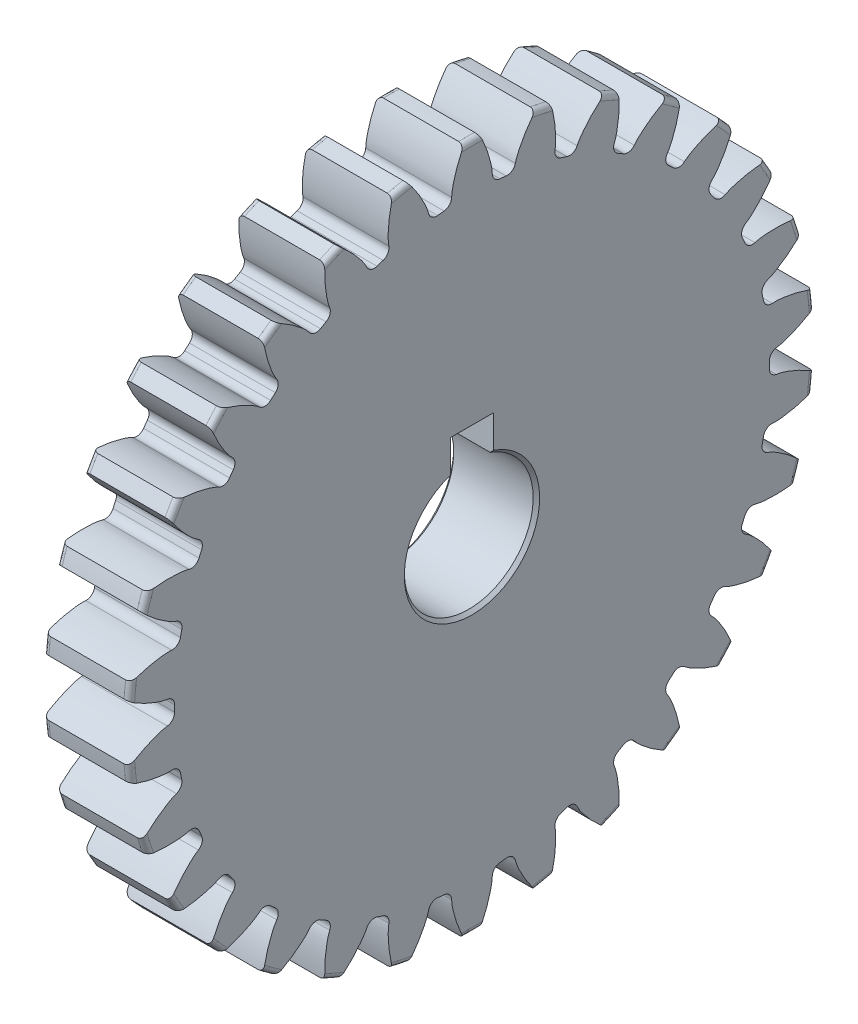
from build123d import *

# Parameters (mm, degrees)
SKETCH1_W                = 9
SKETCH1_H                = 16
CUT_EXTRUDE1_DEPTH       = 25.351591324
CUT_EXTRUDE2_DEPTH       = 25.351591492
CUT_EXTRUDE3_DEPTH       = 25.351591492
CUT_EXTRUDE4_DEPTH       = 25.351591492
CUT_EXTRUDE5_DEPTH       = 25.351591492
CUT_EXTRUDE6_DEPTH       = 25.351591492
CUT_EXTRUDE7_DEPTH       = 25.351591492
CUT_EXTRUDE8_DEPTH       = 25.351591492
CUT_EXTRUDE9_DEPTH       = 25.351591492
CUT_EXTRUDE10_DEPTH      = 25.351591492
CUT_EXTRUDE11_DEPTH      = 25.351591492
CUT_EXTRUDE12_DEPTH      = 25.351591492
CUT_EXTRUDE13_DEPTH      = 25.351591492
CUT_EXTRUDE14_DEPTH      = 25.351591492
CUT_EXTRUDE15_DEPTH      = 25.351591492
CUT_EXTRUDE16_DEPTH      = 25.351591492
CUT_EXTRUDE17_DEPTH      = 25.351591492
CUT_EXTRUDE18_DEPTH      = 25.351591492
CUT_EXTRUDE19_DEPTH      = 25.351591492
CUT_EXTRUDE20_DEPTH      = 25.351591492
CUT_EXTRUDE21_DEPTH      = 25.351591492
CUT_EXTRUDE22_DEPTH      = 25.351591492
CUT_EXTRUDE23_DEPTH      = 25.351591492
CUT_EXTRUDE24_DEPTH      = 25.316579405
CUT_EXTRUDE25_DEPTH      = 25.316579405
CUT_EXTRUDE26_DEPTH      = 25.316579405
CUT_EXTRUDE27_DEPTH      = 25.316579405
CUT_EXTRUDE28_DEPTH      = 25.316579405
CUT_EXTRUDE29_DEPTH      = 25.316579405
CUT_EXTRUDE30_DEPTH      = 25.316579405
FILLET2_R                = 0.39
SKETCH40_W               = 5.946393302
SKETCH40_H               = 34.763530071
SKETCH40_W_2             = 6.26658371
CUT_EXTRUDE31_DEPTH      = 20
F_4_0_4_DIAMETER_HOLE1_D = 6
CUT_EXTRUDE32_DEPTH      = 24.136465443
SKETCH44_W               = 2.236431062
SKETCH44_H               = 33.546465929
SKETCH44_W_2             = 4.204490396
CUT_EXTRUDE33_DEPTH      = 50
CHAMFER1_SIZE            = 0.15
FILLET3_R                = 0.25


with BuildPart() as part:
    # Sketch1 → Revolve1 (revolve)
    with BuildSketch(Plane.XY):
        with Locations((0, 8)):
            Rectangle(SKETCH1_W, SKETCH1_H)
    revolve(axis=Axis((-4.5, 0, 0), (1, 0, 0)))

    # Sketch2 → Cut-Extrude1 (cut, through all)
    with BuildSketch(Plane.ZY.offset(4.5)):
        with BuildLine():
            ThreePointArc((0.954056391, 13.810084192), (1.446987187, 13.767166632), (1.938069328, 13.706660289))
            add(Edge.make_bspline(
                [(1.938069328, 13.706660289), (1.965001199, 13.819362607), (1.991206245, 13.932241789), (2.018962603, 14.04474389), (2.05920042, 14.20783585), (2.123494581, 14.364974044), (2.195334167, 14.516819832), (2.266765719, 14.667803166), (2.344804973, 14.81587551), (2.429738644, 14.959697293), (2.54009773, 15.146573006), (2.662330321, 15.326687166), (2.792289678, 15.50050381), (2.848499158, 15.575682261), (2.906178722, 15.649778454), (2.965092777, 15.722856764)],
                knots=[-0.000345313, -0.000345313, -0.000345313, -0.000345313, 0, 0, 0, 0.000503947, 0.000503947, 0.000503947, 0.001003754, 0.001003754, 0.001003754, 0.001653534, 0.001653534, 0.001653534, 0.001934332, 0.001934332, 0.001934332, 0.001934332], degree=3))
            ThreePointArc((2.965092777, 15.722856764), (1.672455412, 15.912350326), (0.368667349, 15.995752073))
            add(Edge.make_bspline(
                [(0.368667349, 15.995752073), (0.411100156, 15.912021779), (0.452113817, 15.82755251), (0.491464506, 15.74233028), (0.561466025, 15.590727204), (0.626352147, 15.436564899), (0.683841754, 15.279789103), (0.741350469, 15.122961194), (0.791812877, 14.963342867), (0.834422005, 14.801829067), (0.890003895, 14.591140826), (0.938153875, 14.375380258), (0.945223023, 14.157598467), (0.948982336, 14.041783957), (0.951145416, 13.92592313), (0.954056391, 13.810084192)],
                knots=[-0.000281528, -0.000281528, -0.000281528, -0.000281528, 0, 0, 0, 0.000500952, 0.000500952, 0.000500952, 0.001002152, 0.001002152, 0.001002152, 0.00165773, 0.00165773, 0.00165773, 0.002003061, 0.002003061, 0.002003061, 0.002003061], degree=3))
        make_face()
    extrude(amount=-CUT_EXTRUDE1_DEPTH, mode=Mode.SUBTRACT)

    # Sketch3 → Cut-Extrude2 (cut, through all)
    with BuildSketch(Plane.ZY.offset(4.5)):
        with BuildLine():
            ThreePointArc((3.804485924, 13.309941242), (4.277721937, 13.165475458), (4.745492779, 13.004189605))
            add(Edge.make_bspline(
                [(4.745492779, 13.004189605), (4.795268254, 13.108829656), (4.844369558, 13.213793822), (4.894909876, 13.31806661), (4.968177125, 13.469228707), (5.063737172, 13.609565547), (5.165577405, 13.74315685), (5.266839206, 13.875989382), (5.373959086, 14.004600716), (5.486938983, 14.127620945), (5.633740104, 14.287468031), (5.79074946, 14.43823268), (5.954007405, 14.581230943), (6.024619052, 14.643079957), (6.096443643, 14.703564715), (6.16926412, 14.762797168)],
                knots=[-0.000345313, -0.000345313, -0.000345313, -0.000345313, 0, 0, 0, 0.000503947, 0.000503947, 0.000503947, 0.001003754, 0.001003754, 0.001003754, 0.001653534, 0.001653534, 0.001653534, 0.001934313, 0.001934313, 0.001934313, 0.001934313], degree=3))
            ThreePointArc((6.16926412, 14.762797168), (4.94427191, 15.216904261), (3.686314942, 15.56955626))
            add(Edge.make_bspline(
                [(3.686314942, 15.56955626), (3.710411983, 15.478833397), (3.732967249, 15.387682765), (3.753739334, 15.296141377), (3.790691099, 15.133297058), (3.822107159, 14.969012985), (3.845744958, 14.803710355), (3.869390615, 14.638352778), (3.885563781, 14.47173077), (3.89366119, 14.304887499), (3.904223934, 14.087247177), (3.906462577, 13.866190551), (3.868097867, 13.651698056), (3.847695839, 13.537632765), (3.825722831, 13.423854046), (3.804485924, 13.309941242)],
                knots=[-0.000281528, -0.000281528, -0.000281528, -0.000281528, 0, 0, 0, 0.000500952, 0.000500952, 0.000500952, 0.001002152, 0.001002152, 0.001002152, 0.00165773, 0.00165773, 0.00165773, 0.002003061, 0.002003061, 0.002003061, 0.002003061], degree=3))
        make_face()
    extrude(amount=-CUT_EXTRUDE2_DEPTH, mode=Mode.SUBTRACT)

    # Sketch4 → Cut-Extrude3 (cut, through all)
    with BuildSketch(Plane.ZY.offset(4.5)):
        with BuildLine():
            ThreePointArc((6.488641167, 12.22808999), (6.921499712, 11.988389831), (7.345515425, 11.733373434))
            add(Edge.make_bspline(
                [(7.345515425, 11.733373434), (7.415959076, 11.825377946), (7.485810676, 11.917839657), (7.556926098, 12.009325912), (7.660020649, 12.141951637), (7.78267015, 12.25935373), (7.910060123, 12.368851967), (8.036726547, 12.477728277), (8.168245401, 12.58125767), (8.30433376, 12.67809977), (8.481161002, 12.803932145), (8.666085059, 12.918758143), (8.855506437, 13.024688316), (8.937434184, 13.070504794), (9.020264724, 13.114734643), (9.103809017, 13.157532496)],
                knots=[-0.000345313, -0.000345313, -0.000345313, -0.000345313, 0, 0, 0, 0.000503947, 0.000503947, 0.000503947, 0.001003754, 0.001003754, 0.001003754, 0.001653534, 0.001653534, 0.001653534, 0.001934312, 0.001934312, 0.001934312, 0.001934312], degree=3))
            ThreePointArc((9.103809017, 13.157532496), (8, 13.856406461), (6.842852884, 14.462896128))
            add(Edge.make_bspline(
                [(6.842852884, 14.462896128), (6.847561003, 14.369145721), (6.8506721, 14.275297445), (6.85195774, 14.181437696), (6.854244783, 14.014469213), (6.850817747, 13.847243375), (6.839570654, 13.680638429), (6.828319823, 13.513978104), (6.809496904, 13.347634596), (6.782728698, 13.182753704), (6.747810654, 12.967673227), (6.70404012, 12.750981779), (6.621918273, 12.549152931), (6.578246571, 12.441822061), (6.5330978, 12.335098125), (6.488641167, 12.22808999)],
                knots=[-0.000281509, -0.000281509, -0.000281509, -0.000281509, 0, 0, 0, 0.000500952, 0.000500952, 0.000500952, 0.001002152, 0.001002152, 0.001002152, 0.00165773, 0.00165773, 0.00165773, 0.002003061, 0.002003061, 0.002003061, 0.002003061], degree=3))
        make_face()
    extrude(amount=-CUT_EXTRUDE3_DEPTH, mode=Mode.SUBTRACT)

    # Sketch5 → Cut-Extrude4 (cut, through all)
    with BuildSketch(Plane.ZY.offset(4.5)):
        with BuildLine():
            ThreePointArc((8.889211655, 10.611812529), (9.262774737, 10.287354041), (9.624503799, 9.949752541))
            add(Edge.make_bspline(
                [(9.624503799, 9.949752541), (9.7125369, 10.025100475), (9.800085946, 10.101018712), (9.888668388, 10.175720045), (10.017084514, 10.284013017), (10.161463097, 10.373349327), (10.308835257, 10.453968901), (10.455370373, 10.534130571), (10.605540196, 10.608053291), (10.758789302, 10.674484798), (10.957914467, 10.760802983), (11.162671157, 10.834671885), (11.369977345, 10.89890431), (11.459640555, 10.926685852), (11.549856952, 10.952727735), (11.640473776, 10.977220517)],
                knots=[-0.000345313, -0.000345313, -0.000345313, -0.000345313, 0, 0, 0, 0.000503947, 0.000503947, 0.000503947, 0.001003754, 0.001003754, 0.001003754, 0.001653534, 0.001653534, 0.001653534, 0.00193433, 0.00193433, 0.00193433, 0.00193433], degree=3))
            ThreePointArc((11.640473776, 10.977220517), (10.706089702, 11.890317208), (9.700325319, 12.724138034))
            add(Edge.make_bspline(
                [(9.700325319, 12.724138034), (9.685438748, 12.631457425), (9.668969707, 12.539013126), (9.650712713, 12.446937139), (9.618235079, 12.283141814), (9.580114725, 12.120282783), (9.534474293, 11.959656957), (9.488818689, 11.798977739), (9.435822336, 11.64018274), (9.375358415, 11.484470315), (9.296485668, 11.281349732), (9.20861894, 11.078493917), (9.086329076, 10.898149606), (9.021296363, 10.802244031), (8.954945046, 10.707239226), (8.889211655, 10.611812529)],
                knots=[-0.000281509, -0.000281509, -0.000281509, -0.000281509, 0, 0, 0, 0.000500952, 0.000500952, 0.000500952, 0.001002152, 0.001002152, 0.001002152, 0.00165773, 0.00165773, 0.00165773, 0.002003061, 0.002003061, 0.002003061, 0.002003061], degree=3))
        make_face()
    extrude(amount=-CUT_EXTRUDE4_DEPTH, mode=Mode.SUBTRACT)

    # Sketch6 → Cut-Extrude5 (cut, through all)
    with BuildSketch(Plane.ZY.offset(4.5)):
        with BuildLine():
            ThreePointArc((10.901280938, 8.53174794), (11.199222058, 8.136711516), (11.482855173, 7.731279718))
            add(Edge.make_bspline(
                [(11.482855173, 7.731279718), (11.584630256, 7.786678008), (11.686050435, 7.842734779), (11.788228418, 7.897386384), (11.936353719, 7.97661368), (12.096151346, 8.033979782), (12.257064823, 8.08219723), (12.417064344, 8.130140812), (12.579321993, 8.171226081), (12.743034126, 8.20434362), (12.955754487, 8.247375096), (13.171394961, 8.277058475), (13.387525684, 8.296785887), (13.481005645, 8.305318306), (13.574665008, 8.312034068), (13.668393973, 8.317151326)],
                knots=[-0.000345313, -0.000345313, -0.000345313, -0.000345313, 0, 0, 0, 0.000503947, 0.000503947, 0.000503947, 0.001003754, 0.001003754, 0.001003754, 0.001653534, 0.001653534, 0.001653534, 0.001934313, 0.001934313, 0.001934313, 0.001934313], degree=3))
            ThreePointArc((13.668393973, 8.317151326), (12.94427191, 9.404564037), (12.13384699, 10.429274051))
            add(Edge.make_bspline(
                [(12.13384699, 10.429274051), (12.100016344, 10.341713828), (12.06468694, 10.254713764), (12.027685232, 10.168445701), (11.961862349, 10.014982177), (11.89071472, 9.863607674), (11.812675653, 9.715981087), (11.734610646, 9.568305429), (11.649757054, 9.423999044), (11.558239981, 9.284260464), (11.438859649, 9.10197712), (11.310736924, 8.921822711), (11.153623696, 8.770844849), (11.070072214, 8.690556101), (10.985418223, 8.611422594), (10.901280938, 8.53174794)],
                knots=[-0.000281526, -0.000281526, -0.000281526, -0.000281526, 0, 0, 0, 0.000500952, 0.000500952, 0.000500952, 0.001002152, 0.001002152, 0.001002152, 0.00165773, 0.00165773, 0.00165773, 0.002003061, 0.002003061, 0.002003061, 0.002003061], degree=3))
        make_face()
    extrude(amount=-CUT_EXTRUDE5_DEPTH, mode=Mode.SUBTRACT)

    # Sketch7 → Cut-Extrude6 (cut, through all)
    with BuildSketch(Plane.ZY.offset(4.5)):
        with BuildLine():
            ThreePointArc((12.436911934, 6.078805025), (12.646209635, 5.630455653), (12.839350675, 5.174912872))
            add(Edge.make_bspline(
                [(12.839350675, 5.174912872), (12.950419681, 5.207940347), (13.061278443, 5.241685702), (13.1725863, 5.273899041), (13.333946989, 5.320598049), (13.502179738, 5.34348677), (13.66960184, 5.357194757), (13.836073019, 5.370824886), (14.003327057, 5.377277082), (14.17034721, 5.375633256), (14.387365869, 5.373497341), (14.604465602, 5.357697891), (14.81997491, 5.332058109), (14.913186099, 5.320968497), (15.006195066, 5.308064626), (15.098939766, 5.293582713)],
                knots=[-0.000345313, -0.000345313, -0.000345313, -0.000345313, 0, 0, 0, 0.000503947, 0.000503947, 0.000503947, 0.001003754, 0.001003754, 0.001003754, 0.001653534, 0.001653534, 0.001653534, 0.001934313, 0.001934313, 0.001934313, 0.001934313], degree=3))
            ThreePointArc((15.098939766, 5.293582713), (14.616727322, 6.507786289), (14.037061323, 7.678600747))
            add(Edge.make_bspline(
                [(14.037061323, 7.678600747), (13.985765164, 7.599987711), (13.933119462, 7.522234204), (13.87899019, 7.445544392), (13.782698835, 7.309119761), (13.681633423, 7.175845578), (13.574606404, 7.04767022), (13.467543809, 6.919452257), (13.354541487, 6.795941367), (13.235970997, 6.67828388), (13.081300573, 6.524804431), (12.91852143, 6.375225041), (12.73345144, 6.260212084), (12.635032789, 6.199049168), (12.53577591, 6.139245472), (12.436911934, 6.078805025)],
                knots=[-0.000281509, -0.000281509, -0.000281509, -0.000281509, 0, 0, 0, 0.000500952, 0.000500952, 0.000500952, 0.001002152, 0.001002152, 0.001002152, 0.00165773, 0.00165773, 0.00165773, 0.002003061, 0.002003061, 0.002003061, 0.002003061], degree=3))
        make_face()
    extrude(amount=-CUT_EXTRUDE6_DEPTH, mode=Mode.SUBTRACT)

    # Sketch8 → Cut-Extrude7 (cut, through all)
    with BuildSketch(Plane.ZY.offset(4.5)):
        with BuildLine():
            ThreePointArc((13.4289902, 3.360189162), (13.540497168, 2.878121861), (13.634704943, 2.392377502))
            add(Edge.make_bspline(
                [(13.634704943, 2.392377502), (13.750213623, 2.401590702), (13.865665909, 2.411549808), (13.981238951, 2.419917004), (14.148782792, 2.432046753), (14.318098084, 2.419457744), (14.484711663, 2.398057167), (14.65037891, 2.376778141), (14.815319533, 2.34831527), (14.978348125, 2.311981924), (15.190180323, 2.264771967), (15.399251016, 2.204180201), (15.604720118, 2.134293805), (15.693588759, 2.104066831), (15.781882391, 2.07210729), (15.869589438, 2.038659134)],
                knots=[-0.000345313, -0.000345313, -0.000345313, -0.000345313, 0, 0, 0, 0.000503947, 0.000503947, 0.000503947, 0.001003754, 0.001003754, 0.001003754, 0.001653534, 0.001653534, 0.001653534, 0.001934332, 0.001934332, 0.001934332, 0.001934332], degree=3))
            ThreePointArc((15.869589438, 2.038659134), (15.650361612, 3.326587053), (15.326788718, 4.592335744))
            add(Edge.make_bspline(
                [(15.326788718, 4.592335744), (15.260268935, 4.526105663), (15.192607804, 4.460996913), (15.123716679, 4.397237066), (15.001165245, 4.283813739), (14.874599094, 4.174464597), (14.743261717, 4.071342347), (14.611880683, 3.968185819), (14.475668374, 3.870868442), (14.335226567, 3.780434245), (14.152025892, 3.662466479), (13.961704559, 3.549999444), (13.756766255, 3.475978011), (13.647781801, 3.43661404), (13.538260036, 3.398753864), (13.4289902, 3.360189162)],
                knots=[-0.000281509, -0.000281509, -0.000281509, -0.000281509, 0, 0, 0, 0.000500952, 0.000500952, 0.000500952, 0.001002152, 0.001002152, 0.001002152, 0.00165773, 0.00165773, 0.00165773, 0.002003061, 0.002003061, 0.002003061, 0.002003061], degree=3))
        make_face()
    extrude(amount=-CUT_EXTRUDE7_DEPTH, mode=Mode.SUBTRACT)

    # Sketch9 → Cut-Extrude8 (cut, through all)
    with BuildSketch(Plane.ZY.offset(4.5)):
        with BuildLine():
            ThreePointArc((13.834157155, 0.494716908), (13.843, 3.32e-07), (13.834157178, -0.494716245))
            add(Edge.make_bspline(
                [(13.834157178, -0.494716245), (13.949057248, -0.50971998), (14.064057239, -0.523982384), (14.178844371, -0.539827019), (14.345248894, -0.562796657), (14.508246839, -0.610313194), (14.666770081, -0.665887029), (14.824392943, -0.721145215), (14.979811454, -0.783279187), (15.131723352, -0.852714113), (15.329111007, -0.942934809), (15.521015267, -1.045670741), (15.707464177, -1.15674938), (15.788106284, -1.204792651), (15.867825726, -1.254411078), (15.946661901, -1.305363632)],
                knots=[-0.000345313, -0.000345313, -0.000345313, -0.000345313, 0, 0, 0, 0.000503947, 0.000503947, 0.000503947, 0.001003754, 0.001003754, 0.001003754, 0.001653534, 0.001653534, 0.001653534, 0.001934332, 0.001934332, 0.001934332, 0.001934332], degree=3))
            ThreePointArc((15.946661901, -1.305363632), (16, 0), (15.946661901, 1.305363632))
            add(Edge.make_bspline(
                [(15.946661901, 1.305363632), (15.867825726, 1.254411078), (15.788106284, 1.204792651), (15.707464177, 1.15674938), (15.56400875, 1.071284501), (15.417473409, 0.990639482), (15.267565747, 0.917077277), (15.117608256, 0.84349062), (14.964139092, 0.776619992), (14.807963949, 0.717361492), (14.60423977, 0.640061168), (14.394694204, 0.569621837), (14.178844371, 0.539827019), (14.06405726, 0.523982387), (13.949057235, 0.509720402), (13.834157155, 0.494716908)],
                knots=[-0.000281528, -0.000281528, -0.000281528, -0.000281528, 0, 0, 0, 0.000500952, 0.000500952, 0.000500952, 0.001002152, 0.001002152, 0.001002152, 0.00165773, 0.00165773, 0.00165773, 0.002003061, 0.002003061, 0.002003061, 0.002003061], degree=3))
        make_face()
    extrude(amount=-CUT_EXTRUDE8_DEPTH, mode=Mode.SUBTRACT)

    # Sketch10 → Cut-Extrude9 (cut, through all)
    with BuildSketch(Plane.ZY.offset(4.5)):
        with BuildLine():
            ThreePointArc((13.634705058, -2.392376848), (13.540497306, -2.878121211), (13.428990361, -3.360188518))
            add(Edge.make_bspline(
                [(13.428990361, -3.360188518), (13.538260137, -3.398753453), (13.647781782, -3.436614033), (13.756766255, -3.475978011), (13.914758783, -3.533043153), (14.064315588, -3.613410518), (14.207820267, -3.700728766), (14.350509868, -3.787551064), (14.489613733, -3.880640585), (14.623769659, -3.980142451), (14.798085982, -4.109430809), (14.964436673, -4.249820854), (15.123716679, -4.397237066), (15.192607804, -4.460996913), (15.260268935, -4.526105663), (15.326788718, -4.592335744)],
                knots=[-0.000345313, -0.000345313, -0.000345313, -0.000345313, 0, 0, 0, 0.000503947, 0.000503947, 0.000503947, 0.001003754, 0.001003754, 0.001003754, 0.001653534, 0.001653534, 0.001653534, 0.001934332, 0.001934332, 0.001934332, 0.001934332], degree=3))
            ThreePointArc((15.326788718, -4.592335744), (15.650361612, -3.326587053), (15.869589438, -2.038659134))
            add(Edge.make_bspline(
                [(15.869589438, -2.038659134), (15.781882391, -2.07210729), (15.693588759, -2.104066831), (15.604720118, -2.134293805), (15.446630389, -2.188065011), (15.286530154, -2.236481332), (15.124603892, -2.277268471), (14.962623805, -2.318069168), (14.798605126, -2.351570478), (14.633522249, -2.3770634), (14.418178291, -2.410317888), (14.198566638, -2.435650977), (13.981238951, -2.419917003), (13.86566593, -2.41154981), (13.750213698, -2.401590286), (13.634705058, -2.392376848)],
                knots=[-0.000281528, -0.000281528, -0.000281528, -0.000281528, 0, 0, 0, 0.000500952, 0.000500952, 0.000500952, 0.001002152, 0.001002152, 0.001002152, 0.00165773, 0.00165773, 0.00165773, 0.002003061, 0.002003061, 0.002003061, 0.002003061], degree=3))
        make_face()
    extrude(amount=-CUT_EXTRUDE9_DEPTH, mode=Mode.SUBTRACT)

    # Sketch11 → Cut-Extrude10 (cut, through all)
    with BuildSketch(Plane.ZY.offset(4.5)):
        with BuildLine():
            ThreePointArc((12.839350924, -5.174912256), (12.646209905, -5.630455047), (12.436912226, -6.078804429))
            add(Edge.make_bspline(
                [(12.436912226, -6.078804429), (12.535776094, -6.139245092), (12.635032771, -6.199049157), (12.73345144, -6.260212084), (12.876126942, -6.348878709), (13.005706258, -6.458584462), (13.127920531, -6.573830898), (13.249440651, -6.688422756), (13.366150363, -6.808399368), (13.476687059, -6.933619465), (13.620313591, -7.096324964), (13.753840388, -7.268233402), (13.87899019, -7.445544392), (13.933119462, -7.522234204), (13.985765164, -7.599987711), (14.037061323, -7.678600747)],
                knots=[-0.000345313, -0.000345313, -0.000345313, -0.000345313, 0, 0, 0, 0.000503947, 0.000503947, 0.000503947, 0.001003754, 0.001003754, 0.001003754, 0.001653534, 0.001653534, 0.001653534, 0.001934313, 0.001934313, 0.001934313, 0.001934313], degree=3))
            ThreePointArc((14.037061323, -7.678600747), (14.616727322, -6.507786289), (15.098939766, -5.293582713))
            add(Edge.make_bspline(
                [(15.098939766, -5.293582713), (15.006195066, -5.308064626), (14.913186099, -5.320968497), (14.81997491, -5.332058109), (14.654160158, -5.351785582), (14.487492178, -5.36585718), (14.32062427, -5.372086659), (14.153700895, -5.378318209), (13.986301104, -5.376986035), (13.819525407, -5.367599214), (13.601973235, -5.355354486), (13.381893578, -5.334474156), (13.1725863, -5.273899041), (13.061278463, -5.241685708), (12.950419841, -5.207939956), (12.839350924, -5.174912256)],
                knots=[-0.000281528, -0.000281528, -0.000281528, -0.000281528, 0, 0, 0, 0.000500952, 0.000500952, 0.000500952, 0.001002152, 0.001002152, 0.001002152, 0.00165773, 0.00165773, 0.00165773, 0.002003061, 0.002003061, 0.002003061, 0.002003061], degree=3))
        make_face()
    extrude(amount=-CUT_EXTRUDE10_DEPTH, mode=Mode.SUBTRACT)

    # Sketch12 → Cut-Extrude11 (cut, through all)
    with BuildSketch(Plane.ZY.offset(4.5)):
        with BuildLine():
            ThreePointArc((11.482855544, -7.731279167), (11.199222448, -8.136710979), (10.901281347, -8.531747417))
            add(Edge.make_bspline(
                [(10.901281347, -8.531747417), (10.985418482, -8.61142226), (11.070072199, -8.690556086), (11.153623696, -8.770844848), (11.274746568, -8.8872378), (11.378685156, -9.021487274), (11.474267673, -9.159625075), (11.5693073, -9.29697828), (11.658522084, -9.438598428), (11.740608566, -9.584064037), (11.847268139, -9.773075665), (11.942135281, -9.968989274), (12.027685232, -10.168445701), (12.06468694, -10.254713764), (12.100016344, -10.341713828), (12.13384699, -10.429274051)],
                knots=[-0.000345313, -0.000345313, -0.000345313, -0.000345313, 0, 0, 0, 0.000503947, 0.000503947, 0.000503947, 0.001003754, 0.001003754, 0.001003754, 0.001653534, 0.001653534, 0.001653534, 0.00193433, 0.00193433, 0.00193433, 0.00193433], degree=3))
            ThreePointArc((12.13384699, -10.429274051), (12.94427191, -9.404564037), (13.668393973, -8.317151326))
            add(Edge.make_bspline(
                [(13.668393973, -8.317151326), (13.574665008, -8.312034068), (13.481005645, -8.305318306), (13.387525684, -8.296785887), (13.22123281, -8.281607443), (13.055281276, -8.260719321), (12.890764651, -8.232118882), (12.72619334, -8.203508937), (12.56272861, -8.1674015), (12.401548992, -8.123545187), (12.191296678, -8.066336395), (11.980367555, -8.000155217), (11.788228418, -7.897386383), (11.686050453, -7.842734789), (11.584630494, -7.786677658), (11.482855544, -7.731279167)],
                knots=[-0.000281509, -0.000281509, -0.000281509, -0.000281509, 0, 0, 0, 0.000500952, 0.000500952, 0.000500952, 0.001002152, 0.001002152, 0.001002152, 0.00165773, 0.00165773, 0.00165773, 0.002003061, 0.002003061, 0.002003061, 0.002003061], degree=3))
        make_face()
    extrude(amount=-CUT_EXTRUDE11_DEPTH, mode=Mode.SUBTRACT)

    # Sketch13 → Cut-Extrude12 (cut, through all)
    with BuildSketch(Plane.ZY.offset(4.5)):
        with BuildLine():
            ThreePointArc((9.624504276, -9.949752079), (9.262775231, -10.287353597), (8.889212164, -10.611812103))
            add(Edge.make_bspline(
                [(8.889212164, -10.611812103), (8.954945369, -10.707238954), (9.021296351, -10.802244013), (9.086329076, -10.898149606), (9.180605667, -11.037181954), (9.254360912, -11.190107803), (9.319134258, -11.345099683), (9.383539704, -11.499211241), (9.441360447, -11.656285446), (9.491409141, -11.815639021), (9.556440219, -12.022696064), (9.608501557, -12.234052479), (9.650712713, -12.446937139), (9.668969707, -12.539013126), (9.685438748, -12.631457425), (9.700325319, -12.724138034)],
                knots=[-0.000345313, -0.000345313, -0.000345313, -0.000345313, 0, 0, 0, 0.000503947, 0.000503947, 0.000503947, 0.001003754, 0.001003754, 0.001003754, 0.001653534, 0.001653534, 0.001653534, 0.001934313, 0.001934313, 0.001934313, 0.001934313], degree=3))
            ThreePointArc((9.700325319, -12.724138034), (10.706089702, -11.890317208), (11.640473776, -10.977220517))
            add(Edge.make_bspline(
                [(11.640473776, -10.977220517), (11.549856952, -10.952727735), (11.459640555, -10.926685852), (11.369977345, -10.89890431), (11.210474146, -10.849483319), (11.052491936, -10.794548388), (10.897516759, -10.732368008), (10.742490068, -10.670166959), (10.590104593, -10.600862328), (10.441565377, -10.524453254), (10.247801957, -10.424780698), (10.055241982, -10.316191106), (9.888668388, -10.175720045), (9.800085962, -10.101018725), (9.712537205, -10.025100183), (9.624504276, -9.949752079)],
                knots=[-0.000281526, -0.000281526, -0.000281526, -0.000281526, 0, 0, 0, 0.000500952, 0.000500952, 0.000500952, 0.001002152, 0.001002152, 0.001002152, 0.00165773, 0.00165773, 0.00165773, 0.002003061, 0.002003061, 0.002003061, 0.002003061], degree=3))
        make_face()
    extrude(amount=-CUT_EXTRUDE12_DEPTH, mode=Mode.SUBTRACT)

    # Sketch14 → Cut-Extrude13 (cut, through all)
    with BuildSketch(Plane.ZY.offset(4.5)):
        with BuildLine():
            ThreePointArc((7.345515988, -11.733373082), (6.921500288, -11.988389499), (6.488641754, -12.228089679))
            add(Edge.make_bspline(
                [(6.488641754, -12.228089679), (6.533098173, -12.335097926), (6.578246564, -12.441822042), (6.621918273, -12.549152931), (6.685228245, -12.704748294), (6.725576689, -12.869666924), (6.756709958, -13.034738996), (6.787666396, -13.198873491), (6.811566053, -13.364536856), (6.827389592, -13.530813882), (6.847950005, -13.746866954), (6.854930208, -13.964428884), (6.85195774, -14.181437696), (6.8506721, -14.275297445), (6.847561003, -14.369145721), (6.842852884, -14.462896128)],
                knots=[-0.000345313, -0.000345313, -0.000345313, -0.000345313, 0, 0, 0, 0.000503947, 0.000503947, 0.000503947, 0.001003754, 0.001003754, 0.001003754, 0.001653534, 0.001653534, 0.001653534, 0.001934313, 0.001934313, 0.001934313, 0.001934313], degree=3))
            ThreePointArc((6.842852884, -14.462896128), (8, -13.856406461), (9.103809017, -13.157532496))
            add(Edge.make_bspline(
                [(9.103809017, -13.157532496), (9.020264724, -13.114734643), (8.937434184, -13.070504794), (8.855506437, -13.024688316), (8.709763967, -12.943184712), (8.566655662, -12.856603893), (8.427995092, -12.763561152), (8.289288432, -12.670487484), (8.154642189, -12.571014603), (8.02523525, -12.465392212), (7.856429116, -12.32761206), (7.690654084, -12.181359941), (7.556926098, -12.009325912), (7.485810689, -11.917839674), (7.415959435, -11.825377723), (7.345515988, -11.733373082)],
                knots=[-0.000281507, -0.000281507, -0.000281507, -0.000281507, 0, 0, 0, 0.000500952, 0.000500952, 0.000500952, 0.001002152, 0.001002152, 0.001002152, 0.00165773, 0.00165773, 0.00165773, 0.002003061, 0.002003061, 0.002003061, 0.002003061], degree=3))
        make_face()
    extrude(amount=-CUT_EXTRUDE13_DEPTH, mode=Mode.SUBTRACT)

    # Sketch15 → Cut-Extrude14 (cut, through all)
    with BuildSketch(Plane.ZY.offset(4.5)):
        with BuildLine():
            ThreePointArc((4.745493403, -13.004189377), (4.277722569, -13.165475252), (3.804486563, -13.309941059))
            add(Edge.make_bspline(
                [(3.804486563, -13.309941059), (3.825723237, -13.423853928), (3.847695836, -13.537632745), (3.868097867, -13.651698056), (3.897674269, -13.81705617), (3.902852491, -13.986759845), (3.89898501, -14.154697666), (3.895139495, -14.321681635), (3.884073537, -14.488693876), (3.864980356, -14.654627249), (3.840171515, -14.870233792), (3.801765515, -15.084492739), (3.753739334, -15.296141377), (3.732967249, -15.387682765), (3.710411983, -15.478833397), (3.686314942, -15.56955626)],
                knots=[-0.000345313, -0.000345313, -0.000345313, -0.000345313, 0, 0, 0, 0.000503947, 0.000503947, 0.000503947, 0.001003754, 0.001003754, 0.001003754, 0.001653534, 0.001653534, 0.001653534, 0.001934332, 0.001934332, 0.001934332, 0.001934332], degree=3))
            ThreePointArc((3.686314942, -15.56955626), (4.94427191, -15.216904261), (6.16926412, -14.762797168))
            add(Edge.make_bspline(
                [(6.16926412, -14.762797168), (6.096443643, -14.703564715), (6.024619052, -14.643079957), (5.954007405, -14.581230943), (5.82839531, -14.471206825), (5.706415428, -14.356764115), (5.590129599, -14.236925428), (5.473805116, -14.117046906), (5.36278279, -13.991753219), (5.258163834, -13.861533714), (5.121692623, -13.69166762), (4.989947698, -13.514144894), (4.894909876, -13.31806661), (4.844369567, -13.21379384), (4.795268651, -13.108829513), (4.745493403, -13.004189377)],
                knots=[-0.000281509, -0.000281509, -0.000281509, -0.000281509, 0, 0, 0, 0.000500952, 0.000500952, 0.000500952, 0.001002152, 0.001002152, 0.001002152, 0.00165773, 0.00165773, 0.00165773, 0.002003061, 0.002003061, 0.002003061, 0.002003061], degree=3))
        make_face()
    extrude(amount=-CUT_EXTRUDE14_DEPTH, mode=Mode.SUBTRACT)

    # Sketch16 → Cut-Extrude15 (cut, through all)
    with BuildSketch(Plane.ZY.offset(4.5)):
        with BuildLine():
            ThreePointArc((1.938069985, -13.706660196), (1.446987847, -13.767166563), (0.954057053, -13.810084147))
            add(Edge.make_bspline(
                [(0.954057053, -13.810084147), (0.951145838, -13.925923099), (0.948982336, -14.041783936), (0.945223023, -14.157598467), (0.939773224, -14.325492389), (0.909554912, -14.492564245), (0.870855708, -14.656028127), (0.832376307, -14.818563568), (0.78682837, -14.979625449), (0.733652933, -15.137963084), (0.664559104, -15.343700059), (0.582445427, -15.545291877), (0.491464506, -15.74233028), (0.452113817, -15.82755251), (0.411100156, -15.912021779), (0.368667349, -15.995752073)],
                knots=[-0.000345313, -0.000345313, -0.000345313, -0.000345313, 0, 0, 0, 0.000503947, 0.000503947, 0.000503947, 0.001003754, 0.001003754, 0.001003754, 0.001653534, 0.001653534, 0.001653534, 0.001934332, 0.001934332, 0.001934332, 0.001934332], degree=3))
            ThreePointArc((0.368667349, -15.995752073), (1.672455412, -15.912350326), (2.965092777, -15.722856764))
            add(Edge.make_bspline(
                [(2.965092777, -15.722856764), (2.906178722, -15.649778454), (2.848499158, -15.575682261), (2.792289678, -15.50050381), (2.692297809, -15.366767759), (2.596777458, -15.229464853), (2.507948617, -15.088067746), (2.419090249, -14.946623638), (2.33654405, -14.800985078), (2.261285427, -14.651859678), (2.163113586, -14.457331606), (2.071156654, -14.256296867), (2.018962603, -14.04474389), (1.99120625, -13.932241809), (1.965001617, -13.81936255), (1.938069985, -13.706660196)],
                knots=[-0.000281528, -0.000281528, -0.000281528, -0.000281528, 0, 0, 0, 0.000500952, 0.000500952, 0.000500952, 0.001002152, 0.001002152, 0.001002152, 0.00165773, 0.00165773, 0.00165773, 0.002003061, 0.002003061, 0.002003061, 0.002003061], degree=3))
        make_face()
    extrude(amount=-CUT_EXTRUDE15_DEPTH, mode=Mode.SUBTRACT)

    # Sketch17 → Cut-Extrude16 (cut, through all)
    with BuildSketch(Plane.ZY.offset(4.5)):
        with BuildLine():
            ThreePointArc((-0.954056391, -13.810084192), (-1.446987187, -13.767166632), (-1.938069328, -13.706660289))
            add(Edge.make_bspline(
                [(-1.938069328, -13.706660289), (-1.965001199, -13.819362607), (-1.991206245, -13.932241789), (-2.018962603, -14.04474389), (-2.05920042, -14.20783585), (-2.123494581, -14.364974044), (-2.195334167, -14.516819832), (-2.266765719, -14.667803166), (-2.344804973, -14.81587551), (-2.429738644, -14.959697293), (-2.54009773, -15.146573006), (-2.662330321, -15.326687166), (-2.792289678, -15.50050381), (-2.848499158, -15.575682261), (-2.906178722, -15.649778454), (-2.965092777, -15.722856764)],
                knots=[-0.000345313, -0.000345313, -0.000345313, -0.000345313, 0, 0, 0, 0.000503947, 0.000503947, 0.000503947, 0.001003754, 0.001003754, 0.001003754, 0.001653534, 0.001653534, 0.001653534, 0.001934332, 0.001934332, 0.001934332, 0.001934332], degree=3))
            ThreePointArc((-2.965092777, -15.722856764), (-1.672455412, -15.912350326), (-0.368667349, -15.995752073))
            add(Edge.make_bspline(
                [(-0.368667349, -15.995752073), (-0.411100156, -15.912021779), (-0.452113817, -15.82755251), (-0.491464506, -15.74233028), (-0.561466025, -15.590727204), (-0.626352147, -15.436564899), (-0.683841754, -15.279789103), (-0.741350469, -15.122961194), (-0.791812877, -14.963342867), (-0.834422005, -14.801829067), (-0.890003895, -14.591140826), (-0.938153875, -14.375380258), (-0.945223023, -14.157598467), (-0.948982336, -14.041783957), (-0.951145416, -13.92592313), (-0.954056391, -13.810084192)],
                knots=[-0.000281528, -0.000281528, -0.000281528, -0.000281528, 0, 0, 0, 0.000500952, 0.000500952, 0.000500952, 0.001002152, 0.001002152, 0.001002152, 0.00165773, 0.00165773, 0.00165773, 0.002003061, 0.002003061, 0.002003061, 0.002003061], degree=3))
        make_face()
    extrude(amount=-CUT_EXTRUDE16_DEPTH, mode=Mode.SUBTRACT)

    # Sketch18 → Cut-Extrude17 (cut, through all)
    with BuildSketch(Plane.ZY.offset(4.5)):
        with BuildLine():
            ThreePointArc((-3.804485924, -13.309941242), (-4.277721937, -13.165475458), (-4.745492779, -13.004189605))
            add(Edge.make_bspline(
                [(-4.745492779, -13.004189605), (-4.795268254, -13.108829656), (-4.844369558, -13.213793822), (-4.894909876, -13.31806661), (-4.968177125, -13.469228707), (-5.063737172, -13.609565547), (-5.165577405, -13.74315685), (-5.266839206, -13.875989382), (-5.373959086, -14.004600716), (-5.486938983, -14.127620945), (-5.633740104, -14.287468031), (-5.79074946, -14.43823268), (-5.954007405, -14.581230943), (-6.024619052, -14.643079957), (-6.096443643, -14.703564715), (-6.16926412, -14.762797168)],
                knots=[-0.000345313, -0.000345313, -0.000345313, -0.000345313, 0, 0, 0, 0.000503947, 0.000503947, 0.000503947, 0.001003754, 0.001003754, 0.001003754, 0.001653534, 0.001653534, 0.001653534, 0.001934313, 0.001934313, 0.001934313, 0.001934313], degree=3))
            ThreePointArc((-6.16926412, -14.762797168), (-4.94427191, -15.216904261), (-3.686314942, -15.56955626))
            add(Edge.make_bspline(
                [(-3.686314942, -15.56955626), (-3.710411983, -15.478833397), (-3.732967249, -15.387682765), (-3.753739334, -15.296141377), (-3.790691099, -15.133297058), (-3.822107159, -14.969012985), (-3.845744958, -14.803710355), (-3.869390615, -14.638352778), (-3.885563781, -14.47173077), (-3.89366119, -14.304887499), (-3.904223934, -14.087247177), (-3.906462577, -13.866190551), (-3.868097867, -13.651698056), (-3.847695839, -13.537632765), (-3.825722831, -13.423854046), (-3.804485924, -13.309941242)],
                knots=[-0.000281528, -0.000281528, -0.000281528, -0.000281528, 0, 0, 0, 0.000500952, 0.000500952, 0.000500952, 0.001002152, 0.001002152, 0.001002152, 0.00165773, 0.00165773, 0.00165773, 0.002003061, 0.002003061, 0.002003061, 0.002003061], degree=3))
        make_face()
    extrude(amount=-CUT_EXTRUDE17_DEPTH, mode=Mode.SUBTRACT)

    # Sketch19 → Cut-Extrude18 (cut, through all)
    with BuildSketch(Plane.ZY.offset(4.5)):
        with BuildLine():
            ThreePointArc((-6.488641167, -12.22808999), (-6.921499713, -11.988389831), (-7.345515425, -11.733373434))
            add(Edge.make_bspline(
                [(-7.345515425, -11.733373434), (-7.415959076, -11.825377946), (-7.485810676, -11.917839657), (-7.556926098, -12.009325912), (-7.660020649, -12.141951637), (-7.78267015, -12.25935373), (-7.910060123, -12.368851967), (-8.036726547, -12.477728277), (-8.168245401, -12.58125767), (-8.30433376, -12.67809977), (-8.481161002, -12.803932145), (-8.666085059, -12.918758143), (-8.855506437, -13.024688316), (-8.937434184, -13.070504794), (-9.020264724, -13.114734643), (-9.103809017, -13.157532496)],
                knots=[-0.000345313, -0.000345313, -0.000345313, -0.000345313, 0, 0, 0, 0.000503947, 0.000503947, 0.000503947, 0.001003754, 0.001003754, 0.001003754, 0.001653534, 0.001653534, 0.001653534, 0.001934312, 0.001934312, 0.001934312, 0.001934312], degree=3))
            ThreePointArc((-9.103809017, -13.157532496), (-8, -13.856406461), (-6.842852884, -14.462896128))
            add(Edge.make_bspline(
                [(-6.842852884, -14.462896128), (-6.847561003, -14.369145721), (-6.8506721, -14.275297445), (-6.85195774, -14.181437696), (-6.854244783, -14.014469213), (-6.850817747, -13.847243375), (-6.839570654, -13.680638429), (-6.828319823, -13.513978104), (-6.809496904, -13.347634596), (-6.782728698, -13.182753704), (-6.747810654, -12.967673227), (-6.70404012, -12.750981779), (-6.621918273, -12.549152931), (-6.578246571, -12.441822061), (-6.5330978, -12.335098125), (-6.488641167, -12.22808999)],
                knots=[-0.000281509, -0.000281509, -0.000281509, -0.000281509, 0, 0, 0, 0.000500952, 0.000500952, 0.000500952, 0.001002152, 0.001002152, 0.001002152, 0.00165773, 0.00165773, 0.00165773, 0.002003061, 0.002003061, 0.002003061, 0.002003061], degree=3))
        make_face()
    extrude(amount=-CUT_EXTRUDE18_DEPTH, mode=Mode.SUBTRACT)

    # Sketch20 → Cut-Extrude19 (cut, through all)
    with BuildSketch(Plane.ZY.offset(4.5)):
        with BuildLine():
            ThreePointArc((-8.889211655, -10.611812529), (-9.262774737, -10.287354041), (-9.624503799, -9.949752541))
            add(Edge.make_bspline(
                [(-9.624503799, -9.949752541), (-9.7125369, -10.025100475), (-9.800085946, -10.101018712), (-9.888668388, -10.175720045), (-10.017084514, -10.284013017), (-10.161463097, -10.373349327), (-10.308835257, -10.453968901), (-10.455370373, -10.534130571), (-10.605540196, -10.608053291), (-10.758789302, -10.674484798), (-10.957914467, -10.760802983), (-11.162671157, -10.834671885), (-11.369977345, -10.89890431), (-11.459640555, -10.926685852), (-11.549856952, -10.952727735), (-11.640473776, -10.977220517)],
                knots=[-0.000345313, -0.000345313, -0.000345313, -0.000345313, 0, 0, 0, 0.000503947, 0.000503947, 0.000503947, 0.001003754, 0.001003754, 0.001003754, 0.001653534, 0.001653534, 0.001653534, 0.00193433, 0.00193433, 0.00193433, 0.00193433], degree=3))
            ThreePointArc((-11.640473776, -10.977220517), (-10.706089702, -11.890317208), (-9.700325319, -12.724138034))
            add(Edge.make_bspline(
                [(-9.700325319, -12.724138034), (-9.685438748, -12.631457425), (-9.668969707, -12.539013126), (-9.650712713, -12.446937139), (-9.618235079, -12.283141814), (-9.580114725, -12.120282783), (-9.534474293, -11.959656957), (-9.488818689, -11.798977739), (-9.435822336, -11.64018274), (-9.375358415, -11.484470315), (-9.296485668, -11.281349732), (-9.20861894, -11.078493917), (-9.086329076, -10.898149606), (-9.021296363, -10.802244031), (-8.954945046, -10.707239226), (-8.889211655, -10.611812529)],
                knots=[-0.000281509, -0.000281509, -0.000281509, -0.000281509, 0, 0, 0, 0.000500952, 0.000500952, 0.000500952, 0.001002152, 0.001002152, 0.001002152, 0.00165773, 0.00165773, 0.00165773, 0.002003061, 0.002003061, 0.002003061, 0.002003061], degree=3))
        make_face()
    extrude(amount=-CUT_EXTRUDE19_DEPTH, mode=Mode.SUBTRACT)

    # Sketch21 → Cut-Extrude20 (cut, through all)
    with BuildSketch(Plane.ZY.offset(4.5)):
        with BuildLine():
            ThreePointArc((-10.901280938, -8.53174794), (-11.199222058, -8.136711516), (-11.482855173, -7.731279718))
            add(Edge.make_bspline(
                [(-11.482855173, -7.731279718), (-11.584630256, -7.786678008), (-11.686050435, -7.842734779), (-11.788228418, -7.897386384), (-11.936353719, -7.97661368), (-12.096151346, -8.033979782), (-12.257064823, -8.08219723), (-12.417064344, -8.130140812), (-12.579321993, -8.171226081), (-12.743034126, -8.20434362), (-12.955754487, -8.247375096), (-13.171394961, -8.277058475), (-13.387525684, -8.296785887), (-13.481005645, -8.305318306), (-13.574665008, -8.312034068), (-13.668393973, -8.317151326)],
                knots=[-0.000345313, -0.000345313, -0.000345313, -0.000345313, 0, 0, 0, 0.000503947, 0.000503947, 0.000503947, 0.001003754, 0.001003754, 0.001003754, 0.001653534, 0.001653534, 0.001653534, 0.001934313, 0.001934313, 0.001934313, 0.001934313], degree=3))
            ThreePointArc((-13.668393973, -8.317151326), (-12.94427191, -9.404564037), (-12.13384699, -10.429274051))
            add(Edge.make_bspline(
                [(-12.13384699, -10.429274051), (-12.100016344, -10.341713828), (-12.06468694, -10.254713764), (-12.027685232, -10.168445701), (-11.961862349, -10.014982177), (-11.89071472, -9.863607674), (-11.812675653, -9.715981087), (-11.734610646, -9.568305429), (-11.649757054, -9.423999044), (-11.558239981, -9.284260464), (-11.438859649, -9.10197712), (-11.310736924, -8.921822711), (-11.153623696, -8.770844849), (-11.070072214, -8.690556101), (-10.985418223, -8.611422594), (-10.901280938, -8.53174794)],
                knots=[-0.000281526, -0.000281526, -0.000281526, -0.000281526, 0, 0, 0, 0.000500952, 0.000500952, 0.000500952, 0.001002152, 0.001002152, 0.001002152, 0.00165773, 0.00165773, 0.00165773, 0.002003061, 0.002003061, 0.002003061, 0.002003061], degree=3))
        make_face()
    extrude(amount=-CUT_EXTRUDE20_DEPTH, mode=Mode.SUBTRACT)

    # Sketch22 → Cut-Extrude21 (cut, through all)
    with BuildSketch(Plane.ZY.offset(4.5)):
        with BuildLine():
            ThreePointArc((-12.436911934, -6.078805025), (-12.646209635, -5.630455653), (-12.839350675, -5.174912872))
            add(Edge.make_bspline(
                [(-12.839350675, -5.174912872), (-12.950419681, -5.207940347), (-13.061278443, -5.241685702), (-13.1725863, -5.273899041), (-13.333946989, -5.320598049), (-13.502179738, -5.34348677), (-13.66960184, -5.357194757), (-13.836073019, -5.370824886), (-14.003327057, -5.377277081), (-14.17034721, -5.375633256), (-14.387365869, -5.373497341), (-14.604465602, -5.357697891), (-14.81997491, -5.332058109), (-14.913186099, -5.320968497), (-15.006195066, -5.308064626), (-15.098939766, -5.293582713)],
                knots=[-0.000345313, -0.000345313, -0.000345313, -0.000345313, 0, 0, 0, 0.000503947, 0.000503947, 0.000503947, 0.001003754, 0.001003754, 0.001003754, 0.001653534, 0.001653534, 0.001653534, 0.001934332, 0.001934332, 0.001934332, 0.001934332], degree=3))
            ThreePointArc((-15.098939766, -5.293582713), (-14.616727322, -6.507786289), (-14.037061323, -7.678600747))
            add(Edge.make_bspline(
                [(-14.037061323, -7.678600747), (-13.985765164, -7.599987711), (-13.933119462, -7.522234204), (-13.87899019, -7.445544392), (-13.782698835, -7.309119761), (-13.681633423, -7.175845578), (-13.574606404, -7.04767022), (-13.467543809, -6.919452257), (-13.354541487, -6.795941367), (-13.235970997, -6.67828388), (-13.081300573, -6.524804431), (-12.91852143, -6.375225041), (-12.73345144, -6.260212084), (-12.635032789, -6.199049168), (-12.53577591, -6.139245472), (-12.436911934, -6.078805025)],
                knots=[-0.000281509, -0.000281509, -0.000281509, -0.000281509, 0, 0, 0, 0.000500952, 0.000500952, 0.000500952, 0.001002152, 0.001002152, 0.001002152, 0.00165773, 0.00165773, 0.00165773, 0.002003061, 0.002003061, 0.002003061, 0.002003061], degree=3))
        make_face()
    extrude(amount=-CUT_EXTRUDE21_DEPTH, mode=Mode.SUBTRACT)

    # Sketch23 → Cut-Extrude22 (cut, through all)
    with BuildSketch(Plane.ZY.offset(4.5)):
        with BuildLine():
            ThreePointArc((-13.4289902, -3.360189162), (-13.540497168, -2.878121861), (-13.634704943, -2.392377502))
            add(Edge.make_bspline(
                [(-13.634704943, -2.392377502), (-13.750213623, -2.401590702), (-13.865665909, -2.411549808), (-13.981238951, -2.419917003), (-14.148782792, -2.432046753), (-14.318098084, -2.419457744), (-14.484711663, -2.398057167), (-14.65037891, -2.376778141), (-14.815319533, -2.34831527), (-14.978348125, -2.311981924), (-15.190180323, -2.264771967), (-15.399251016, -2.204180201), (-15.604720118, -2.134293805), (-15.693588759, -2.104066831), (-15.781882391, -2.07210729), (-15.869589438, -2.038659134)],
                knots=[-0.000345313, -0.000345313, -0.000345313, -0.000345313, 0, 0, 0, 0.000503947, 0.000503947, 0.000503947, 0.001003754, 0.001003754, 0.001003754, 0.001653534, 0.001653534, 0.001653534, 0.001934332, 0.001934332, 0.001934332, 0.001934332], degree=3))
            ThreePointArc((-15.869589438, -2.038659134), (-15.650361612, -3.326587053), (-15.326788718, -4.592335744))
            add(Edge.make_bspline(
                [(-15.326788718, -4.592335744), (-15.260268935, -4.526105663), (-15.192607804, -4.460996913), (-15.123716679, -4.397237066), (-15.001165245, -4.283813739), (-14.874599094, -4.174464597), (-14.743261717, -4.071342347), (-14.611880683, -3.968185819), (-14.475668374, -3.870868442), (-14.335226567, -3.780434245), (-14.152025892, -3.662466479), (-13.961704559, -3.549999444), (-13.756766255, -3.475978011), (-13.647781801, -3.43661404), (-13.538260036, -3.398753864), (-13.4289902, -3.360189162)],
                knots=[-0.000281528, -0.000281528, -0.000281528, -0.000281528, 0, 0, 0, 0.000500952, 0.000500952, 0.000500952, 0.001002152, 0.001002152, 0.001002152, 0.00165773, 0.00165773, 0.00165773, 0.002003061, 0.002003061, 0.002003061, 0.002003061], degree=3))
        make_face()
    extrude(amount=-CUT_EXTRUDE22_DEPTH, mode=Mode.SUBTRACT)

    # Sketch24 → Cut-Extrude23 (cut, through all)
    with BuildSketch(Plane.ZY.offset(4.5)):
        with BuildLine():
            ThreePointArc((-15.946661901, 1.305363632), (-16, 0), (-15.946661901, -1.305363632))
            add(Edge.make_bspline(
                [(-15.946661901, -1.305363632), (-15.867825726, -1.254411078), (-15.788106284, -1.204792651), (-15.707464177, -1.15674938), (-15.56400875, -1.071284501), (-15.417473409, -0.990639482), (-15.267565747, -0.917077277), (-15.117608256, -0.84349062), (-14.964139092, -0.776619992), (-14.807963949, -0.717361492), (-14.60423977, -0.640061168), (-14.394694204, -0.569621837), (-14.178844371, -0.539827019), (-14.06405726, -0.523982387), (-13.949057235, -0.509720402), (-13.834157155, -0.494716908)],
                knots=[-0.000281528, -0.000281528, -0.000281528, -0.000281528, 0, 0, 0, 0.000500952, 0.000500952, 0.000500952, 0.001002152, 0.001002152, 0.001002152, 0.00165773, 0.00165773, 0.00165773, 0.002003061, 0.002003061, 0.002003061, 0.002003061], degree=3))
            ThreePointArc((-13.834157155, -0.494716908), (-13.843, -3.32e-07), (-13.834157178, 0.494716245))
            add(Edge.make_bspline(
                [(-13.834157178, 0.494716245), (-13.949057248, 0.50971998), (-14.064057239, 0.523982384), (-14.178844371, 0.539827019), (-14.345248894, 0.562796657), (-14.508246839, 0.610313194), (-14.666770081, 0.665887029), (-14.824392943, 0.721145215), (-14.979811454, 0.783279187), (-15.131723352, 0.852714113), (-15.329111007, 0.942934809), (-15.521015267, 1.045670741), (-15.707464177, 1.15674938), (-15.788106284, 1.204792651), (-15.867825726, 1.254411078), (-15.946661901, 1.305363632)],
                knots=[-0.000345313, -0.000345313, -0.000345313, -0.000345313, 0, 0, 0, 0.000503947, 0.000503947, 0.000503947, 0.001003754, 0.001003754, 0.001003754, 0.001653534, 0.001653534, 0.001653534, 0.001934332, 0.001934332, 0.001934332, 0.001934332], degree=3))
        make_face()
    extrude(amount=-CUT_EXTRUDE23_DEPTH, mode=Mode.SUBTRACT)

    # Sketch25 → Cut-Extrude24 (cut, through all)
    with BuildSketch(Plane.ZY.offset(4.5)):
        with BuildLine():
            ThreePointArc((-15.326788718, 4.592335744), (-15.650361612, 3.326587053), (-15.869589438, 2.038659134))
            add(Edge.make_bspline(
                [(-15.869589438, 2.038659134), (-15.781882391, 2.07210729), (-15.693588759, 2.104066831), (-15.604720118, 2.134293805), (-15.446630389, 2.188065011), (-15.286530154, 2.236481332), (-15.124603892, 2.277268471), (-14.962623805, 2.318069168), (-14.798605126, 2.351570478), (-14.633522249, 2.3770634), (-14.418178291, 2.410317888), (-14.198566638, 2.435650977), (-13.981238951, 2.419917003), (-13.86566593, 2.41154981), (-13.750213698, 2.401590286), (-13.634705058, 2.392376848)],
                knots=[-0.000281528, -0.000281528, -0.000281528, -0.000281528, 0, 0, 0, 0.000500952, 0.000500952, 0.000500952, 0.001002152, 0.001002152, 0.001002152, 0.00165773, 0.00165773, 0.00165773, 0.002003061, 0.002003061, 0.002003061, 0.002003061], degree=3))
            ThreePointArc((-13.634705058, 2.392376848), (-13.540497306, 2.878121211), (-13.428990361, 3.360188518))
            add(Edge.make_bspline(
                [(-13.428990361, 3.360188518), (-13.538260137, 3.398753453), (-13.647781782, 3.436614033), (-13.756766255, 3.475978011), (-13.914758783, 3.533043153), (-14.064315588, 3.613410518), (-14.207820267, 3.700728766), (-14.350509868, 3.787551064), (-14.489613733, 3.880640585), (-14.623769659, 3.980142451), (-14.798085982, 4.109430809), (-14.964436673, 4.249820854), (-15.123716679, 4.397237066), (-15.192607804, 4.460996913), (-15.260268935, 4.526105663), (-15.326788718, 4.592335744)],
                knots=[-0.000345313, -0.000345313, -0.000345313, -0.000345313, 0, 0, 0, 0.000503947, 0.000503947, 0.000503947, 0.001003754, 0.001003754, 0.001003754, 0.001653534, 0.001653534, 0.001653534, 0.001934313, 0.001934313, 0.001934313, 0.001934313], degree=3))
        make_face()
    extrude(amount=-CUT_EXTRUDE24_DEPTH, mode=Mode.SUBTRACT)

    # Sketch26 → Cut-Extrude25 (cut, through all)
    with BuildSketch(Plane.ZY.offset(4.5)):
        with BuildLine():
            ThreePointArc((-14.037061323, 7.678600747), (-14.616727322, 6.507786289), (-15.098939766, 5.293582713))
            add(Edge.make_bspline(
                [(-15.098939766, 5.293582713), (-15.006195066, 5.308064626), (-14.913186099, 5.320968497), (-14.81997491, 5.332058109), (-14.654160158, 5.351785582), (-14.487492178, 5.36585718), (-14.32062427, 5.372086659), (-14.153700895, 5.378318209), (-13.986301104, 5.376986035), (-13.819525407, 5.367599214), (-13.601973235, 5.355354486), (-13.381893578, 5.334474156), (-13.1725863, 5.273899041), (-13.061278463, 5.241685708), (-12.950419841, 5.207939956), (-12.839350924, 5.174912256)],
                knots=[-0.000281509, -0.000281509, -0.000281509, -0.000281509, 0, 0, 0, 0.000500952, 0.000500952, 0.000500952, 0.001002152, 0.001002152, 0.001002152, 0.00165773, 0.00165773, 0.00165773, 0.002003061, 0.002003061, 0.002003061, 0.002003061], degree=3))
            ThreePointArc((-12.839350924, 5.174912256), (-12.646209905, 5.630455047), (-12.436912226, 6.078804429))
            add(Edge.make_bspline(
                [(-12.436912226, 6.078804429), (-12.535776094, 6.139245092), (-12.635032771, 6.199049157), (-12.73345144, 6.260212083), (-12.876126942, 6.348878709), (-13.005706258, 6.458584462), (-13.127920531, 6.573830898), (-13.249440651, 6.688422756), (-13.366150363, 6.808399368), (-13.476687059, 6.933619465), (-13.620313591, 7.096324964), (-13.753840388, 7.268233402), (-13.87899019, 7.445544392), (-13.933119462, 7.522234204), (-13.985765164, 7.599987711), (-14.037061323, 7.678600747)],
                knots=[-0.000345313, -0.000345313, -0.000345313, -0.000345313, 0, 0, 0, 0.000503947, 0.000503947, 0.000503947, 0.001003754, 0.001003754, 0.001003754, 0.001653534, 0.001653534, 0.001653534, 0.001934313, 0.001934313, 0.001934313, 0.001934313], degree=3))
        make_face()
    extrude(amount=-CUT_EXTRUDE25_DEPTH, mode=Mode.SUBTRACT)

    # Sketch27 → Cut-Extrude26 (cut, through all)
    with BuildSketch(Plane.ZY.offset(4.5)):
        with BuildLine():
            ThreePointArc((-12.13384699, 10.429274051), (-12.94427191, 9.404564037), (-13.668393973, 8.317151326))
            add(Edge.make_bspline(
                [(-13.668393973, 8.317151326), (-13.574665008, 8.312034068), (-13.481005645, 8.305318306), (-13.387525684, 8.296785887), (-13.22123281, 8.281607443), (-13.055281276, 8.260719321), (-12.890764651, 8.232118882), (-12.72619334, 8.203508937), (-12.56272861, 8.1674015), (-12.401548992, 8.123545187), (-12.191296678, 8.066336395), (-11.980367555, 8.000155217), (-11.788228418, 7.897386383), (-11.686050453, 7.842734789), (-11.584630494, 7.786677658), (-11.482855544, 7.731279167)],
                knots=[-0.000281509, -0.000281509, -0.000281509, -0.000281509, 0, 0, 0, 0.000500952, 0.000500952, 0.000500952, 0.001002152, 0.001002152, 0.001002152, 0.00165773, 0.00165773, 0.00165773, 0.002003061, 0.002003061, 0.002003061, 0.002003061], degree=3))
            ThreePointArc((-11.482855544, 7.731279167), (-11.199222448, 8.136710979), (-10.901281347, 8.531747417))
            add(Edge.make_bspline(
                [(-10.901281347, 8.531747417), (-10.985418482, 8.61142226), (-11.070072199, 8.690556086), (-11.153623696, 8.770844848), (-11.274746568, 8.8872378), (-11.378685156, 9.021487274), (-11.474267673, 9.159625075), (-11.5693073, 9.29697828), (-11.658522084, 9.438598428), (-11.740608566, 9.584064037), (-11.847268139, 9.773075665), (-11.942135281, 9.968989274), (-12.027685232, 10.168445701), (-12.06468694, 10.254713764), (-12.100016344, 10.341713828), (-12.13384699, 10.429274051)],
                knots=[-0.000345313, -0.000345313, -0.000345313, -0.000345313, 0, 0, 0, 0.000503947, 0.000503947, 0.000503947, 0.001003754, 0.001003754, 0.001003754, 0.001653534, 0.001653534, 0.001653534, 0.00193433, 0.00193433, 0.00193433, 0.00193433], degree=3))
        make_face()
    extrude(amount=-CUT_EXTRUDE26_DEPTH, mode=Mode.SUBTRACT)

    # Sketch28 → Cut-Extrude27 (cut, through all)
    with BuildSketch(Plane.ZY.offset(4.5)):
        with BuildLine():
            ThreePointArc((-9.700325319, 12.724138034), (-10.706089702, 11.890317208), (-11.640473776, 10.977220517))
            add(Edge.make_bspline(
                [(-11.640473776, 10.977220517), (-11.549856952, 10.952727735), (-11.459640555, 10.926685852), (-11.369977345, 10.89890431), (-11.210474146, 10.849483319), (-11.052491936, 10.794548388), (-10.897516759, 10.732368008), (-10.742490068, 10.670166959), (-10.590104593, 10.600862328), (-10.441565377, 10.524453254), (-10.247801957, 10.424780698), (-10.055241982, 10.316191106), (-9.888668388, 10.175720045), (-9.800085962, 10.101018725), (-9.712537205, 10.025100183), (-9.624504276, 9.949752079)],
                knots=[-0.000281526, -0.000281526, -0.000281526, -0.000281526, 0, 0, 0, 0.000500952, 0.000500952, 0.000500952, 0.001002152, 0.001002152, 0.001002152, 0.00165773, 0.00165773, 0.00165773, 0.002003061, 0.002003061, 0.002003061, 0.002003061], degree=3))
            ThreePointArc((-9.624504276, 9.949752079), (-9.262775231, 10.287353597), (-8.889212164, 10.611812103))
            add(Edge.make_bspline(
                [(-8.889212164, 10.611812103), (-8.954945369, 10.707238954), (-9.021296351, 10.802244013), (-9.086329076, 10.898149606), (-9.180605667, 11.037181954), (-9.254360912, 11.190107803), (-9.319134258, 11.345099683), (-9.383539704, 11.499211241), (-9.441360447, 11.656285446), (-9.491409141, 11.815639021), (-9.556440219, 12.022696064), (-9.608501557, 12.234052479), (-9.650712713, 12.446937139), (-9.668969707, 12.539013126), (-9.685438748, 12.631457425), (-9.700325319, 12.724138034)],
                knots=[-0.000345313, -0.000345313, -0.000345313, -0.000345313, 0, 0, 0, 0.000503947, 0.000503947, 0.000503947, 0.001003754, 0.001003754, 0.001003754, 0.001653534, 0.001653534, 0.001653534, 0.001934313, 0.001934313, 0.001934313, 0.001934313], degree=3))
        make_face()
    extrude(amount=-CUT_EXTRUDE27_DEPTH, mode=Mode.SUBTRACT)

    # Sketch29 → Cut-Extrude28 (cut, through all)
    with BuildSketch(Plane.ZY.offset(4.5)):
        with BuildLine():
            ThreePointArc((-6.842852884, 14.462896128), (-8, 13.856406461), (-9.103809017, 13.157532496))
            add(Edge.make_bspline(
                [(-9.103809017, 13.157532496), (-9.020264724, 13.114734643), (-8.937434184, 13.070504794), (-8.855506437, 13.024688316), (-8.709763967, 12.943184712), (-8.566655662, 12.856603893), (-8.427995092, 12.763561152), (-8.289288432, 12.670487484), (-8.154642189, 12.571014603), (-8.02523525, 12.465392212), (-7.856429116, 12.32761206), (-7.690654084, 12.181359941), (-7.556926098, 12.009325912), (-7.485810689, 11.917839674), (-7.415959435, 11.825377723), (-7.345515988, 11.733373082)],
                knots=[-0.000281507, -0.000281507, -0.000281507, -0.000281507, 0, 0, 0, 0.000500952, 0.000500952, 0.000500952, 0.001002152, 0.001002152, 0.001002152, 0.00165773, 0.00165773, 0.00165773, 0.002003061, 0.002003061, 0.002003061, 0.002003061], degree=3))
            ThreePointArc((-7.345515988, 11.733373082), (-6.921500288, 11.988389499), (-6.488641754, 12.228089679))
            add(Edge.make_bspline(
                [(-6.488641754, 12.228089679), (-6.533098173, 12.335097926), (-6.578246564, 12.441822042), (-6.621918273, 12.549152931), (-6.685228245, 12.704748294), (-6.725576689, 12.869666924), (-6.756709958, 13.034738996), (-6.787666396, 13.198873491), (-6.811566053, 13.364536856), (-6.827389592, 13.530813882), (-6.847950005, 13.746866954), (-6.854930208, 13.964428884), (-6.85195774, 14.181437696), (-6.8506721, 14.275297445), (-6.847561003, 14.369145721), (-6.842852884, 14.462896128)],
                knots=[-0.000345313, -0.000345313, -0.000345313, -0.000345313, 0, 0, 0, 0.000503947, 0.000503947, 0.000503947, 0.001003754, 0.001003754, 0.001003754, 0.001653534, 0.001653534, 0.001653534, 0.001934313, 0.001934313, 0.001934313, 0.001934313], degree=3))
        make_face()
    extrude(amount=-CUT_EXTRUDE28_DEPTH, mode=Mode.SUBTRACT)

    # Sketch30 → Cut-Extrude29 (cut, through all)
    with BuildSketch(Plane.ZY.offset(4.5)):
        with BuildLine():
            ThreePointArc((-3.686314942, 15.56955626), (-4.94427191, 15.216904261), (-6.16926412, 14.762797168))
            add(Edge.make_bspline(
                [(-6.16926412, 14.762797168), (-6.096443643, 14.703564715), (-6.024619052, 14.643079957), (-5.954007405, 14.581230943), (-5.82839531, 14.471206825), (-5.706415428, 14.356764115), (-5.590129599, 14.236925428), (-5.473805116, 14.117046906), (-5.36278279, 13.991753219), (-5.258163834, 13.861533714), (-5.121692623, 13.69166762), (-4.989947698, 13.514144894), (-4.894909876, 13.31806661), (-4.844369567, 13.21379384), (-4.795268651, 13.108829513), (-4.745493403, 13.004189377)],
                knots=[-0.000281509, -0.000281509, -0.000281509, -0.000281509, 0, 0, 0, 0.000500952, 0.000500952, 0.000500952, 0.001002152, 0.001002152, 0.001002152, 0.00165773, 0.00165773, 0.00165773, 0.002003061, 0.002003061, 0.002003061, 0.002003061], degree=3))
            ThreePointArc((-4.745493403, 13.004189377), (-4.277722569, 13.165475252), (-3.804486563, 13.309941059))
            add(Edge.make_bspline(
                [(-3.804486563, 13.309941059), (-3.825723237, 13.423853928), (-3.847695836, 13.537632745), (-3.868097867, 13.651698056), (-3.897674269, 13.81705617), (-3.902852491, 13.986759845), (-3.89898501, 14.154697666), (-3.895139495, 14.321681635), (-3.884073537, 14.488693876), (-3.864980356, 14.654627249), (-3.840171515, 14.870233792), (-3.801765515, 15.084492739), (-3.753739334, 15.296141377), (-3.732967249, 15.387682765), (-3.710411983, 15.478833397), (-3.686314942, 15.56955626)],
                knots=[-0.000345313, -0.000345313, -0.000345313, -0.000345313, 0, 0, 0, 0.000503947, 0.000503947, 0.000503947, 0.001003754, 0.001003754, 0.001003754, 0.001653534, 0.001653534, 0.001653534, 0.001934332, 0.001934332, 0.001934332, 0.001934332], degree=3))
        make_face()
    extrude(amount=-CUT_EXTRUDE29_DEPTH, mode=Mode.SUBTRACT)

    # Sketch31 → Cut-Extrude30 (cut, through all)
    with BuildSketch(Plane.ZY.offset(4.5)):
        with BuildLine():
            ThreePointArc((-0.368667349, 15.995752073), (-1.672455412, 15.912350326), (-2.965092777, 15.722856764))
            add(Edge.make_bspline(
                [(-2.965092777, 15.722856764), (-2.906178722, 15.649778454), (-2.848499158, 15.575682261), (-2.792289678, 15.50050381), (-2.692297809, 15.366767759), (-2.596777458, 15.229464853), (-2.507948617, 15.088067746), (-2.419090249, 14.946623638), (-2.33654405, 14.800985078), (-2.261285427, 14.651859678), (-2.163113586, 14.457331606), (-2.071156654, 14.256296867), (-2.018962603, 14.04474389), (-1.99120625, 13.932241809), (-1.965001617, 13.81936255), (-1.938069985, 13.706660196)],
                knots=[-0.000281528, -0.000281528, -0.000281528, -0.000281528, 0, 0, 0, 0.000500952, 0.000500952, 0.000500952, 0.001002152, 0.001002152, 0.001002152, 0.00165773, 0.00165773, 0.00165773, 0.002003061, 0.002003061, 0.002003061, 0.002003061], degree=3))
            ThreePointArc((-1.938069985, 13.706660196), (-1.446987847, 13.767166563), (-0.954057053, 13.810084147))
            add(Edge.make_bspline(
                [(-0.954057053, 13.810084147), (-0.951145838, 13.925923099), (-0.948982336, 14.041783936), (-0.945223023, 14.157598467), (-0.939773224, 14.325492389), (-0.909554912, 14.492564245), (-0.870855708, 14.656028127), (-0.832376307, 14.818563568), (-0.78682837, 14.979625449), (-0.733652933, 15.137963084), (-0.664559104, 15.343700059), (-0.582445427, 15.545291877), (-0.491464506, 15.74233028), (-0.452113817, 15.82755251), (-0.411100156, 15.912021779), (-0.368667349, 15.995752073)],
                knots=[-0.000345313, -0.000345313, -0.000345313, -0.000345313, 0, 0, 0, 0.000503947, 0.000503947, 0.000503947, 0.001003754, 0.001003754, 0.001003754, 0.001653534, 0.001653534, 0.001653534, 0.001934332, 0.001934332, 0.001934332, 0.001934332], degree=3))
        make_face()
    extrude(amount=-CUT_EXTRUDE30_DEPTH, mode=Mode.SUBTRACT)

    # Fillet2
    fillet2_edges = [part.edges().sort_by_distance(p)[0] for p in [
        (0, -0.494716908, -13.834157155),
        (0, 9.949752079, -9.624504276),
        (0, 5.174912256, -12.839350924),
        (0, -13.810084147, 0.954057053),
        (0, 13.004189377, -4.745493403),
        (0, -13.706660196, 1.938069985),
        (0, 2.392376848, -13.634705058),
        (0, -13.810084192, -0.954056391),
        (0, 7.731279167, -11.482855544),
        (0, -13.706660289, -1.938069328),
        (0, 11.733373082, -7.345515988),
        (0, -13.309941059, 3.804486563),
        (0, 13.810084147, -0.954057053),
        (0, -13.004189377, 4.745493403),
        (0, 2.392377502, 13.634704943),
        (0, -13.309941242, -3.804485924),
        (0, 5.174912872, 12.839350675),
        (0, -13.004189605, -4.745492779),
        (0, 7.731279718, 11.482855173),
        (0, -12.228089679, 6.488641754),
        (0, 9.949752541, 9.624503799),
        (0, -11.733373082, 7.345515988),
        (0, 11.733373434, 7.345515425),
        (0, -12.22808999, -6.488641167),
        (0, 13.004189605, 4.745492779),
        (0, -11.733373434, -7.345515425),
        (0, 13.706660289, 1.938069328),
        (0, -10.611812103, 8.889212164),
        (0, 0.494716908, 13.834157155),
        (0, -9.949752079, 9.624504276),
        (0, 0.494716245, -13.834157178),
        (0, -10.611812529, -8.889211655),
        (0, 3.360189162, 13.4289902),
        (0, -9.949752541, -9.624503799),
        (0, 3.360188518, -13.428990361),
        (0, -8.531747417, 10.901281347),
        (0, 6.078805025, 12.436911934),
        (0, -7.731279167, 11.482855544),
        (0, 6.078804429, -12.436912226),
        (0, -8.53174794, -10.901280938),
        (0, 8.53174794, 10.901280938),
        (0, -7.731279718, -11.482855173),
        (0, 8.531747417, -10.901281347),
        (0, -6.078804429, 12.436912226),
        (0, 10.611812529, 8.889211655),
        (0, -5.174912256, 12.839350924),
        (0, 10.611812103, -8.889212164),
        (0, -6.078805025, -12.436911934),
        (0, 12.22808999, 6.488641167),
        (0, -5.174912872, -12.839350675),
        (0, 12.228089679, -6.488641754),
        (0, -3.360188518, 13.428990361),
        (0, 13.309941242, 3.804485924),
        (0, -2.392376848, 13.634705058),
        (0, 13.309941059, -3.804486563),
        (0, -3.360189162, -13.4289902),
        (0, 13.810084192, 0.954056391),
        (0, -2.392377502, -13.634704943),
        (0, -0.494716245, 13.834157178),
        (0, 13.706660196, -1.938069985),
    ]]
    fillet(fillet2_edges, radius=FILLET2_R)

    # Sketch40 → Cut-Extrude31 (cut, symmetric)
    with BuildSketch(Plane(origin=(0, 0, 0), x_dir=(1, 0, 0), z_dir=(0, 1, 0))):
        with Locations((-5.473196651, -0.160095205)):
            Rectangle(SKETCH40_W, SKETCH40_H)
        with Locations((5.633291855, -0.160095205)):
            Rectangle(SKETCH40_W_2, SKETCH40_H)
    extrude(amount=CUT_EXTRUDE31_DEPTH, both=True, mode=Mode.SUBTRACT)

    # Ø4.0 (4) Diameter Hole1 (through all)
    with Locations(Plane.ZY.offset(2.5)):
        with Locations((0, 0)):
            Hole(F_4_0_4_DIAMETER_HOLE1_D / 2)

    # Sketch43 → Cut-Extrude32 (cut, through all)
    with BuildSketch(Plane(origin=(2.5, 0, 0), x_dir=(0, 0, -1), z_dir=(1, 0, 0))):
        with BuildLine():
            Line((-1, 2.828427125), (-1, 4.5))
            Line((-1, 4.5), (1, 4.5))
            Line((1, 4.5), (1, 2.828427125))
            ThreePointArc((1, 2.828427125), (0, 3), (-1, 2.828427125))
        make_face()
    extrude(amount=-CUT_EXTRUDE32_DEPTH, mode=Mode.SUBTRACT)

    # Sketch44 → Cut-Extrude33 (cut, symmetric)
    with BuildSketch(Plane(origin=(0, 0, 0), x_dir=(1, 0, 0), z_dir=(0, 1, 0))):
        with Locations((-3.118215531, 0.022364311)):
            Rectangle(SKETCH44_W, SKETCH44_H)
        with Locations((4.102245198, 0.022364311)):
            Rectangle(SKETCH44_W_2, SKETCH44_H)
    extrude(amount=CUT_EXTRUDE33_DEPTH, both=True, mode=Mode.SUBTRACT)

    # Chamfer1
    chamfer1_edges = [part.edges().sort_by_distance(p)[0] for p in [
        (2, -3, 0),
        (-2, -3, 0),
    ]]
    chamfer(chamfer1_edges, length=CHAMFER1_SIZE)

    # Fillet3
    fillet3_edges = [part.edges().sort_by_distance(p)[0] for p in [
        (-2, 15.650361612, -3.326587053),
        (-2, 16, 0),
        (-2, 15.650361612, 3.326587053),
        (-2, 14.616727322, 6.507786289),
        (-2, 12.94427191, 9.404564037),
        (-2, 10.706089702, 11.890317208),
        (-2, 8, 13.856406461),
        (-2, 4.94427191, 15.216904261),
        (-2, 1.672455412, 15.912350326),
        (-2, -1.672455412, 15.912350326),
        (-2, -4.94427191, 15.216904261),
        (-2, -8, 13.856406461),
        (-2, -10.706089702, 11.890317208),
        (-2, -12.94427191, 9.404564037),
        (-2, -14.616727322, 6.507786289),
        (-2, -15.650361612, 3.326587053),
        (-2, -16, 0),
        (-2, -15.650361612, -3.326587053),
        (-2, -14.616727322, -6.507786289),
        (-2, -12.94427191, -9.404564037),
        (-2, -10.706089702, -11.890317208),
        (-2, -8, -13.856406461),
        (-2, -4.94427191, -15.216904261),
        (-2, -1.672455412, -15.912350326),
        (-2, 1.672455412, -15.912350326),
        (-2, 4.94427191, -15.216904261),
        (-2, 8, -13.856406461),
        (-2, 10.706089702, -11.890317208),
        (-2, 12.94427191, -9.404564037),
        (-2, 14.616727322, -6.507786289),
        (2, 10.706089702, -11.890317208),
        (2, 12.94427191, -9.404564037),
        (2, 14.616727322, -6.507786289),
        (2, 15.650361612, -3.326587053),
        (2, 16, 0),
        (2, 15.650361612, 3.326587053),
        (2, 14.616727322, 6.507786289),
        (2, 12.94427191, 9.404564037),
        (2, 10.706089702, 11.890317208),
        (2, 8, 13.856406461),
        (2, 4.94427191, 15.216904261),
        (2, 1.672455412, 15.912350326),
        (2, -1.672455412, 15.912350326),
        (2, -4.94427191, 15.216904261),
        (2, -8, 13.856406461),
        (2, -10.706089702, 11.890317208),
        (2, -12.94427191, 9.404564037),
        (2, -14.616727322, 6.507786289),
        (2, -15.650361612, 3.326587053),
        (2, -16, 0),
        (2, -15.650361612, -3.326587053),
        (2, -14.616727322, -6.507786289),
        (2, -12.94427191, -9.404564037),
        (2, -10.706089702, -11.890317208),
        (2, -8, -13.856406461),
        (2, -4.94427191, -15.216904261),
        (2, -1.672455412, -15.912350326),
        (2, 1.672455412, -15.912350326),
        (2, 4.94427191, -15.216904261),
        (2, 8, -13.856406461),
    ]]
    fillet(fillet3_edges, radius=FILLET3_R)


solid = part.part
